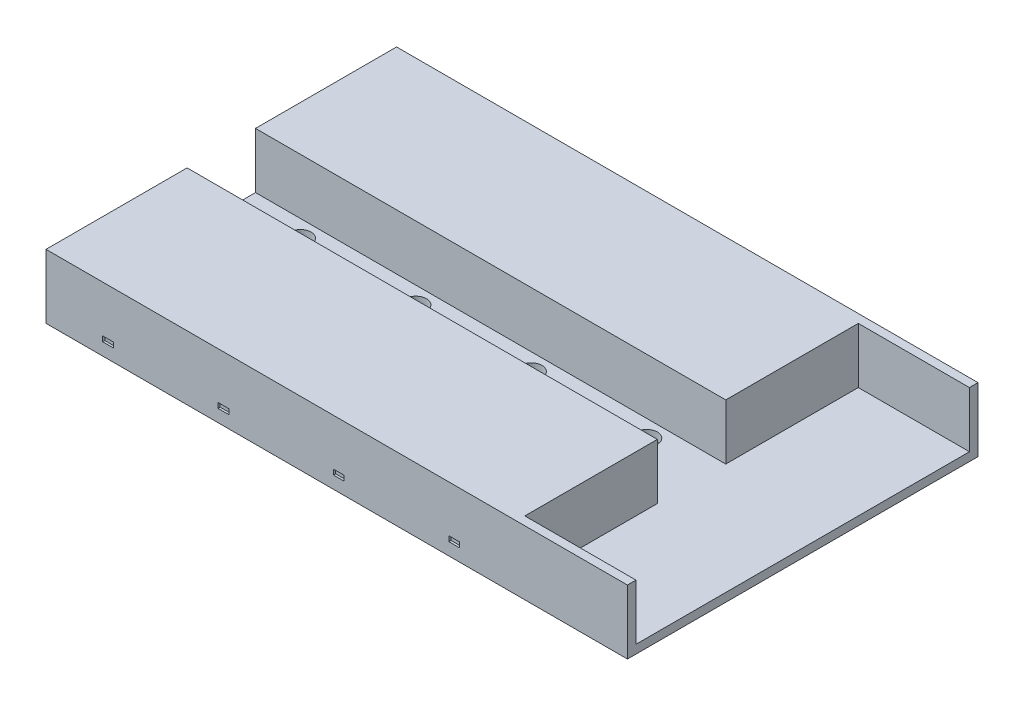
from build123d import *
from build123d.topology import SkipClean

# Parameters (mm, degrees)
EXTRUDE_1_DEPTH        = 15
SKETCH_4_W             = 25
SKETCH_4_H             = 29
CUT_EXTRUDE_2_DEPTH    = 13
PATTERN_LINEAR_1_COUNT = 4
PATTERN_LINEAR_1_PITCH = 27
CUT_EXTRUDE_3_DEPTH    = 149.559752288
EXTRUDE_2_DEPTH        = 142
CUT_EXTRUDE_4_DEPTH    = 149.559752288
SKETCH_14_W            = 21
SKETCH_14_H            = 4
CUT_EXTRUDE_7_DEPTH    = 84.348665256
PATTERN_LINEAR_3_COUNT = 5
PATTERN_LINEAR_3_PITCH = 27
CUT_EXTRUDE_8_DEPTH    = 84.348665256
SKETCH_17_R            = 2.5
CUT_EXTRUDE_9_DEPTH    = 84.348665256
PATTERN_LINEAR_4_COUNT = 4
PATTERN_LINEAR_4_PITCH = 27
SKETCH_21_W            = 31
SKETCH_21_H            = 13
CUT_EXTRUDE_11_DEPTH   = 32
CUT_EXTRUDE_12_DEPTH   = 0.5
PATTERN_LINEAR_5_COUNT = 4
PATTERN_LINEAR_5_PITCH = 27
CUT_EXTRUDE_13_DEPTH   = 6


# Read off the part's stored shape, not the designer's step: 镜向1
with BuildPart() as part:
    # 草图3 → 凸台-拉伸1 (new body)
    with BuildSketch(Plane(origin=(0, 0, 0), x_dir=(1, 0, 0), z_dir=(0, 1, 0))):
        Polygon((0, 0), (-71, 0), (-71, 41), (71, 41), (71, 0), align=None)
    extrude(amount=EXTRUDE_1_DEPTH)

    # 草图4 → 切除-拉伸2 (cut)
    with BuildSketch(Plane(origin=(0, 0, 0), x_dir=(1, 0, 0), z_dir=(0, 1, 0))):
        with Locations((-56.5, 24.5)):
            Rectangle(SKETCH_4_W, SKETCH_4_H)
    cut_extrude_2 = extrude(amount=CUT_EXTRUDE_2_DEPTH, mode=Mode.SUBTRACT)

    # 阵列(线性)1: 切除-拉伸2 ×4
    with Locations(*[(i * PATTERN_LINEAR_1_PITCH, 0, 0) for i in range(1, PATTERN_LINEAR_1_COUNT)]):
        add(cut_extrude_2, mode=Mode.SUBTRACT)

    # 草图6 → 切除-拉伸3 (cut, through all)
    with BuildSketch(Plane(origin=(71, 0, 0), x_dir=(0, 0, -1), z_dir=(1, 0, 0))):
        Polygon((0, 15), (7.5, 15), (8, 15), (8, 2), (7.5, 2), (0, 2), align=None)
    extrude(amount=-CUT_EXTRUDE_3_DEPTH, mode=Mode.SUBTRACT)

    # 草图7 → 凸台-拉伸2 (add)
    with BuildSketch(Plane(origin=(71, 0, 0), x_dir=(0, 0, -1), z_dir=(1, 0, 0))):
        with BuildLine():
            Line((0, 0), (4, 0))
            ThreePointArc((4, 0), (2.828427125, -2.828427125), (0, -4))
            Line((0, -4), (0, 0))
        make_face()
    extrude(amount=-EXTRUDE_2_DEPTH)

    # 草图8 → 切除-拉伸4 (cut, through all)
    with BuildSketch(Plane(origin=(71, 0, 0), x_dir=(0, 0, -1), z_dir=(1, 0, 0))):
        with BuildLine():
            Line((0, -1), (0, -2))
            Line((0, -2), (0, -3))
            ThreePointArc((0, -3), (1, -2), (0, -1))
        make_face()
    extrude(amount=-CUT_EXTRUDE_4_DEPTH, mode=Mode.SUBTRACT)

    # 草图14 → 切除-拉伸7 (cut, through all)
    with BuildSketch(Plane.XY):
        with Locations((-56.5, -2)):
            Rectangle(SKETCH_14_W, SKETCH_14_H)
    cut_extrude_7 = extrude(amount=-CUT_EXTRUDE_7_DEPTH, mode=Mode.SUBTRACT)

    # 阵列(线性)3: 切除-拉伸7 ×5
    with Locations(*[(i * PATTERN_LINEAR_3_PITCH, 0, 0) for i in range(1, PATTERN_LINEAR_3_COUNT)]):
        add(cut_extrude_7, mode=Mode.SUBTRACT)

    # 草图16 → 切除-拉伸8 (cut, through all)
    with BuildSketch(Plane.XY):
        Polygon((71, -1), (71, 0), (42.178247133, 0), (42.178247133, -4), (71, -4), align=None)
    extrude(amount=-CUT_EXTRUDE_8_DEPTH, mode=Mode.SUBTRACT)

    # 草图17 → 切除-拉伸9 (cut, through all)
    with BuildSketch(Plane.XZ):
        with Locations(Location((-56.5, -4, 0), (0, 0, 270))):
            Circle(SKETCH_17_R)
    cut_extrude_9 = extrude(amount=-CUT_EXTRUDE_9_DEPTH, mode=Mode.SUBTRACT)

    # 阵列(线性)4: 切除-拉伸9 ×4
    with Locations(*[(i * PATTERN_LINEAR_4_PITCH, 0, 0) for i in range(1, PATTERN_LINEAR_4_COUNT)]):
        add(cut_extrude_9, mode=Mode.SUBTRACT)

    # 草图21 → 切除-拉伸11 (cut)
    with BuildSketch(Plane(origin=(71, 0, 0), x_dir=(0, 0, -1), z_dir=(1, 0, 0))):
        with Locations((23.5, 8.5)):
            Rectangle(SKETCH_21_W, SKETCH_21_H)
    extrude(amount=-CUT_EXTRUDE_11_DEPTH, mode=Mode.SUBTRACT)

    # 草图23 → 切除-拉伸12 (cut)
    with BuildSketch(Plane(origin=(0, 0, -41), x_dir=(-1, 0, 0), z_dir=(0, 0, -1))):
        Polygon((55.25, 2.9), (56.5, 2.9), (57.75, 2.9), (57.75, 3.5), (57.75, 4.1), (55.25, 4.1), (55.25, 3.5), align=None)
    cut_extrude_12 = extrude(amount=-CUT_EXTRUDE_12_DEPTH, mode=Mode.SUBTRACT)

    # 阵列(线性)5: 切除-拉伸12 ×4
    with Locations(*[(i * PATTERN_LINEAR_5_PITCH, 0, 0) for i in range(1, PATTERN_LINEAR_5_COUNT)]):
        add(cut_extrude_12, mode=Mode.SUBTRACT)

    # 镜向1: part across plane


with BuildPart() as part_1:
    with SkipClean():  # the faces are left unmerged after this step: merging them gives an invalid solid
        add(part.part)
        add(part.part.mirror(Plane.XY))

    # 草图25 → 切除-拉伸13 (cut)
    with SkipClean():  # the faces are left unmerged after this step: merging them gives an invalid solid
        with BuildSketch(Plane(origin=(71, 0, 0), x_dir=(0, 0, -1), z_dir=(1, 0, 0))):
            Polygon((41, 15), (41, 0), (-41, 0), (-41, 15), (-39, 15), (-39, 2), (39, 2), (39, 15), align=None)
        extrude(amount=-CUT_EXTRUDE_13_DEPTH, mode=Mode.SUBTRACT)


solid = part_1.part
